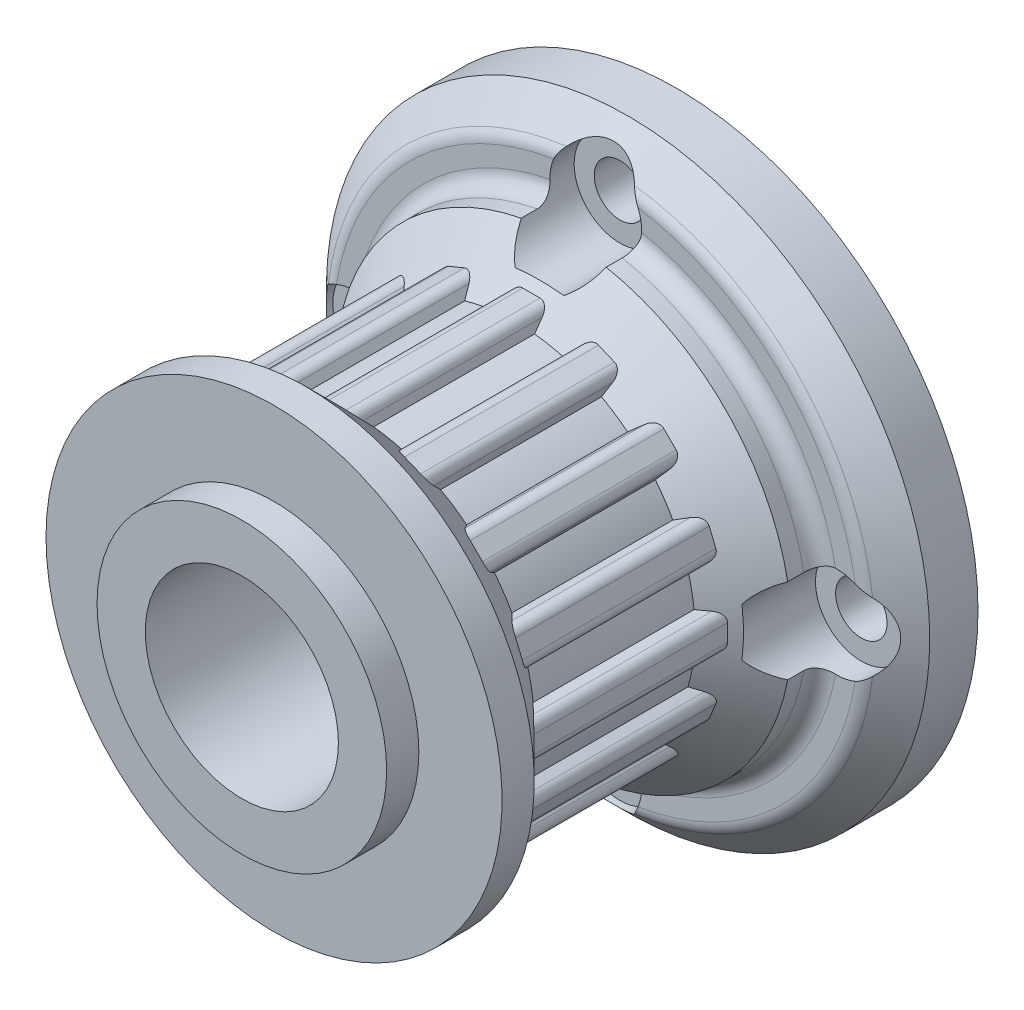
from build123d import *
from build123d.topology import SkipClean

# Parameters (mm, degrees)
ESQUISSE11_R                 = 18.75
ESQUISSE11_R_2               = 1.6
BOSS_EXTRU_4_DEPTH           = 5
ESQUISSE5_R                  = 6
BOSS_EXTRU_5_DEPTH           = 24
ESQUISSE12_R                 = 1.6
ENL_V_MAT_EXTRU_7_DEPTH      = 32
ENL_V_MAT_EXTRU_9_DEPTH      = 3.5
ENL_V_MAT_EXTRU_9_DEPTH_BACK = 1.5
ESQUISSE15_R                 = 2.85
CHANFREIN1_SIZE              = 2
CONG_1_R                     = 1
ESQUISSE16_R                 = 9
ESQUISSE16_R_2               = 6
BOSS_EXTRU_6_DEPTH           = 2


with BuildPart() as part:
    # Esquisse11 → Boss.-Extru.4 (new body)
    with BuildSketch(Plane.XY):
        Circle(ESQUISSE11_R)
        with Locations((-15, 0)):
            Circle(ESQUISSE11_R_2, mode=Mode.SUBTRACT)
        with Locations((0, 15)):
            Circle(ESQUISSE11_R_2, mode=Mode.SUBTRACT)
        with Locations((15, 0)):
            Circle(ESQUISSE11_R_2, mode=Mode.SUBTRACT)
        with Locations((0, -15)):
            Circle(ESQUISSE11_R_2, mode=Mode.SUBTRACT)
    extrude(amount=BOSS_EXTRU_4_DEPTH)

    # Esquisse5 → Boss.-Extru.5 (add)
    with BuildSketch(Plane.XY):
        with BuildLine():
            Line((0, 12.187189413), (0.508919212, 12.187189413))
            ThreePointArc((0.508919212, 12.187189413), (0.899044051, 12.043043128), (1.101718736, 11.679864778))
            Line((1.101718736, 11.679864778), (1.223875428, 10.898487461))
            Line((1.223875428, 10.898487461), (2.990113971, 10.551498398))
            Line((2.990113971, 10.551498398), (3.397524082, 11.2264814))
            ThreePointArc((3.397524082, 11.2264814), (3.723877023, 11.486437733), (4.140815501, 11.470758379))
            Line((4.140815501, 11.470758379), (4.661933908, 11.254904067))
            Line((4.661933908, 11.254904067), (5.132113951, 11.060149116))
            ThreePointArc((5.132113951, 11.060149116), (5.43737991, 10.777681002), (5.485644567, 10.364587714))
            Line((5.485644567, 10.364587714), (5.29948248, 9.595941861))
            Line((5.29948248, 9.595941861), (6.798487154, 8.59945554))
            Line((6.798487154, 8.59945554), (7.433189829, 9.06714942))
            ThreePointArc((7.433189829, 9.06714942), (7.834181612, 9.182427892), (8.21338231, 9.00838661))
            Line((8.21338231, 9.00838661), (8.612229071, 8.609539849))
            Line((8.612229071, 8.609539849), (8.972089297, 8.249679623))
            ThreePointArc((8.972089297, 8.249679623), (9.146022401, 7.871892888), (9.032529172, 7.47177437))
            Line((9.032529172, 7.47177437), (8.566389797, 6.832879345))
            Line((8.566389797, 6.832879345), (9.569950728, 5.338601775))
            Line((9.569950728, 5.338601775), (10.335318239, 5.52780438))
            ThreePointArc((10.335318239, 5.52780438), (10.749901501, 5.480854889), (11.033634549, 5.174947886))
            Line((11.033634549, 5.174947886), (11.249488861, 4.653829479))
            Line((11.249488861, 4.653829479), (11.444243812, 4.183649436))
            ThreePointArc((11.444243812, 4.183649436), (11.460364322, 3.768058687), (11.202391523, 3.441829356))
            Line((11.202391523, 3.441829356), (10.527240354, 3.029951135))
            Line((10.527240354, 3.029951135), (10.882574489, 1.26537253))
            Line((10.882574489, 1.26537253), (11.662086569, 1.147279478))
            ThreePointArc((11.662086569, 1.147279478), (12.027144767, 0.945249658), (12.172214381, 0.554048503))
            Line((12.172214381, 0.554048503), (12.172214381, -0.010005996))
            Line((12.172214381, -0.010005996), (12.172214381, -0.518925208))
            ThreePointArc((12.172214381, -0.518925208), (12.028068096, -0.909050047), (11.664889747, -1.111724733))
            Line((11.664889747, -1.111724733), (10.88351243, -1.233881424))
            Line((10.88351243, -1.233881424), (10.536523367, -3.000119967))
            Line((10.536523367, -3.000119967), (11.211506369, -3.407530078))
            ThreePointArc((11.211506369, -3.407530078), (11.471462701, -3.733883019), (11.455783348, -4.150821497))
            Line((11.455783348, -4.150821497), (11.239929036, -4.671939904))
            Line((11.239929036, -4.671939904), (11.045174085, -5.142119947))
            ThreePointArc((11.045174085, -5.142119947), (10.76270597, -5.447385906), (10.349612682, -5.495650563))
            Line((10.349612682, -5.495650563), (9.580966829, -5.309488476))
            Line((9.580966829, -5.309488476), (8.584480508, -6.80849315))
            Line((8.584480508, -6.80849315), (9.052174389, -7.443195825))
            ThreePointArc((9.052174389, -7.443195825), (9.167452861, -7.844187609), (8.993411579, -8.223388306))
            Line((8.993411579, -8.223388306), (8.594564817, -8.622235067))
            Line((8.594564817, -8.622235067), (8.234704592, -8.982095293))
            ThreePointArc((8.234704592, -8.982095293), (7.856917857, -9.156028397), (7.456799339, -9.042535168))
            Line((7.456799339, -9.042535168), (6.817904314, -8.576395793))
            Line((6.817904314, -8.576395793), (5.323626744, -9.579956724))
            Line((5.323626744, -9.579956724), (5.512829349, -10.345324235))
            ThreePointArc((5.512829349, -10.345324235), (5.465879858, -10.759907497), (5.159972855, -11.043640545))
            Line((5.159972855, -11.043640545), (4.638854448, -11.259494857))
            Line((4.638854448, -11.259494857), (4.168674404, -11.454249808))
            ThreePointArc((4.168674404, -11.454249808), (3.753083655, -11.470370318), (3.426854324, -11.212397519))
            Line((3.426854324, -11.212397519), (3.014976103, -10.53724635))
            Line((3.014976103, -10.53724635), (1.250397498, -10.892580485))
            Line((1.250397498, -10.892580485), (1.132304447, -11.672092565))
            ThreePointArc((1.132304447, -11.672092565), (0.930274627, -12.037150763), (0.539073472, -12.182220377))
            Line((0.539073472, -12.182220377), (-0.024981027, -12.182220377))
            Line((-0.024981027, -12.182220377), (-0.533900239, -12.182220377))
            ThreePointArc((-0.533900239, -12.182220377), (-0.924025078, -12.038074093), (-1.126699764, -11.674895743))
            Line((-1.126699764, -11.674895743), (-1.248856456, -10.893518426))
            Line((-1.248856456, -10.893518426), (-3.015094998, -10.546529363))
            Line((-3.015094998, -10.546529363), (-3.42250511, -11.221512365))
            ThreePointArc((-3.42250511, -11.221512365), (-3.74885805, -11.481468697), (-4.165796528, -11.465789344))
            Line((-4.165796528, -11.465789344), (-4.686914935, -11.249935032))
            Line((-4.686914935, -11.249935032), (-5.157094979, -11.055180081))
            ThreePointArc((-5.157094979, -11.055180081), (-5.462360938, -10.772711966), (-5.510625594, -10.359618678))
            Line((-5.510625594, -10.359618678), (-5.324463507, -9.590972826))
            Line((-5.324463507, -9.590972826), (-6.823468181, -8.594486504))
            Line((-6.823468181, -8.594486504), (-7.458170856, -9.062180385))
            ThreePointArc((-7.458170856, -9.062180385), (-7.85916264, -9.177458857), (-8.238363337, -9.003417575))
            Line((-8.238363337, -9.003417575), (-8.637210099, -8.604570813))
            Line((-8.637210099, -8.604570813), (-8.997070324, -8.244710588))
            ThreePointArc((-8.997070324, -8.244710588), (-9.171003428, -7.866923853), (-9.057510199, -7.466805335))
            Line((-9.057510199, -7.466805335), (-8.591370824, -6.82791031))
            Line((-8.591370824, -6.82791031), (-9.594931756, -5.33363274))
            Line((-9.594931756, -5.33363274), (-10.360299266, -5.522835345))
            ThreePointArc((-10.360299266, -5.522835345), (-10.774882529, -5.475885854), (-11.058615577, -5.169978851))
            Line((-11.058615577, -5.169978851), (-11.274469888, -4.648860444))
            Line((-11.274469888, -4.648860444), (-11.469224839, -4.178680401))
            ThreePointArc((-11.469224839, -4.178680401), (-11.48534535, -3.763089651), (-11.22737255, -3.43686032))
            Line((-11.22737255, -3.43686032), (-10.552221381, -3.024982099))
            Line((-10.552221381, -3.024982099), (-10.907555516, -1.260403495))
            Line((-10.907555516, -1.260403495), (-11.687067596, -1.142310443))
            ThreePointArc((-11.687067596, -1.142310443), (-12.052125795, -0.940280623), (-12.197195409, -0.549079468))
            Line((-12.197195409, -0.549079468), (-12.197195409, 0.014975031))
            Line((-12.197195409, 0.014975031), (-12.197195409, 0.523894243))
            ThreePointArc((-12.197195409, 0.523894243), (-12.053049124, 0.914019082), (-11.689870774, 1.116693768))
            Line((-11.689870774, 1.116693768), (-10.908493457, 1.238850459))
            Line((-10.908493457, 1.238850459), (-10.561504394, 3.005089002))
            Line((-10.561504394, 3.005089002), (-11.236487396, 3.412499114))
            ThreePointArc((-11.236487396, 3.412499114), (-11.496443729, 3.738852054), (-11.480764375, 4.155790532))
            Line((-11.480764375, 4.155790532), (-11.264910063, 4.676908939))
            Line((-11.264910063, 4.676908939), (-11.070155112, 5.147088983))
            ThreePointArc((-11.070155112, 5.147088983), (-10.787686998, 5.452354942), (-10.37459371, 5.500619598))
            Line((-10.37459371, 5.500619598), (-9.605947857, 5.314457511))
            Line((-9.605947857, 5.314457511), (-8.609461536, 6.813462185))
            Line((-8.609461536, 6.813462185), (-9.077155416, 7.44816486))
            ThreePointArc((-9.077155416, 7.44816486), (-9.192433888, 7.849156644), (-9.018392606, 8.228357341))
            Line((-9.018392606, 8.228357341), (-8.619545845, 8.627204103))
            Line((-8.619545845, 8.627204103), (-8.259685619, 8.987064328))
            ThreePointArc((-8.259685619, 8.987064328), (-7.881898884, 9.160997432), (-7.481780366, 9.047504203))
            Line((-7.481780366, 9.047504203), (-6.842885341, 8.581364828))
            Line((-6.842885341, 8.581364828), (-5.348607771, 9.58492576))
            Line((-5.348607771, 9.58492576), (-5.537810376, 10.35029327))
            ThreePointArc((-5.537810376, 10.35029327), (-5.490860885, 10.764876533), (-5.184953883, 11.04860958))
            Line((-5.184953883, 11.04860958), (-4.663835475, 11.264463892))
            Line((-4.663835475, 11.264463892), (-4.193655432, 11.459218843))
            ThreePointArc((-4.193655432, 11.459218843), (-3.778064683, 11.475339354), (-3.451835352, 11.217366554))
            Line((-3.451835352, 11.217366554), (-3.039957131, 10.542215385))
            Line((-3.039957131, 10.542215385), (-1.275378526, 10.89754952))
            Line((-1.275378526, 10.89754952), (-1.157285475, 11.6770616))
            ThreePointArc((-1.157285475, 11.6770616), (-0.955255654, 12.042119799), (-0.564054499, 12.187189413))
            Line((-0.564054499, 12.187189413), (0, 12.187189413))
        make_face()
        Circle(ESQUISSE5_R, mode=Mode.SUBTRACT)
    extrude(amount=BOSS_EXTRU_5_DEPTH)

    # Esquisse12 → Enlèv. mat.-Extru.7 (cut)
    with BuildSketch(Plane.XY.offset(5)):
        Circle(ESQUISSE12_R)
    extrude(amount=-ENL_V_MAT_EXTRU_7_DEPTH, mode=Mode.SUBTRACT)

    # Esquisse13 → Révolution1 (revolve)
    with BuildSketch(Plane(origin=(0, 0, 0), x_dir=(1, 0, 0), z_dir=(0, 1, 0)), mode=Mode.PRIVATE) as r_volution1_sk:
        Polygon((6, -5), (6, -25), (14.172214381, -25), (14.172214381, -23), (11.172214381, -20), (11.172214381, -10), (14.172214381, -7), (14.172214381, -5), align=None)
    revolve(r_volution1_sk.sketch.rotate(Axis((0, 0, 0), (0, 0, 1)), 180), axis=Axis((0, 0, 0), (0, 0, 1)))

    # Esquisse15 → Enlèv. mat.-Extru.9 (cut, two sides: drawn at the far end of the back side and taken through both)
    with BuildSketch(Plane.XY.offset(5).offset(-ENL_V_MAT_EXTRU_9_DEPTH_BACK)):
        with Locations(Location((15, 0, 0), (0, 0, 211.962839165))):
            Circle(ESQUISSE15_R)
        with Locations(Location((0, 15, 0), (0, 0, 202.174997284))):
            Circle(ESQUISSE15_R)
        with Locations(Location((0, -15, 0), (0, 0, 157.825002716))):
            Circle(ESQUISSE15_R)
        with Locations(Location((-15, 0, 0), (0, 0, 292.174997284))):
            Circle(ESQUISSE15_R)
    extrude(amount=ENL_V_MAT_EXTRU_9_DEPTH + ENL_V_MAT_EXTRU_9_DEPTH_BACK, mode=Mode.SUBTRACT)

    # Chanfrein1
    # the kernel refuses this chamfer: 2 mm, written as the material it takes off along each edge
    with BuildSketch(Plane(origin=(0, 0, 5), x_dir=(1, 0, 0), z_dir=(0, -1, 0))) as chanfrein1_piece_1:
        Polygon((18.75, -CHANFREIN1_SIZE), (18.75 - CHANFREIN1_SIZE, 0), (18.75, 0), align=None)
    revolve(axis=Axis((0, 0, 5), (0, 0, 1)), mode=Mode.SUBTRACT)

    # Congé1
    # the kernel refuses this fillet: 1 mm, written as the material it adds along each edge
    with BuildSketch(Plane(origin=(0, 0, 5), x_dir=(0.9999408731145155, 0.010874294229071135, 0), z_dir=(0.010874294229071135, -0.9999408731145155, 0))) as cong_1_piece_1_section:
        with BuildLine():
            CenterArc((14.172214381 + CONG_1_R, CONG_1_R), CONG_1_R, 180, 90)
            Line((14.172214381 + CONG_1_R, 0), (14.172214381, 0))
            Line((14.172214381, 0), (14.172214381, CONG_1_R))
        make_face()
    cong_1_piece_1 = revolve(axis=Axis((0, 0, 5), (0, 0, 1)), revolution_arc=88.753873111, mode=Mode.PRIVATE)
    cong_1_piece_1 = cong_1_piece_1 - Plane(origin=(15, 0, 5.281325989), x_dir=(-0.848391612230621, -0.5293691266939616, 0), z_dir=(0, 0, 1)) * Cylinder(2.85, 61, mode=Mode.PRIVATE)
    cong_1_piece_1 = cong_1_piece_1 - Plane(origin=(0, 15, 5.281325989), x_dir=(-0.9260353787045638, -0.37743671971271575, 0), z_dir=(0, 0, 1)) * Cylinder(2.85, 61, mode=Mode.PRIVATE)
    add(cong_1_piece_1)
    with BuildSketch(Plane(origin=(0, 0, 5), x_dir=(-0.010874294228895224, 0.9999408731145174, 0), z_dir=(0.9999408731145174, 0.010874294228895224, 0))) as cong_1_piece_2_section:
        with BuildLine():
            CenterArc((14.172214381 + CONG_1_R, CONG_1_R), CONG_1_R, 180, 90)
            Line((14.172214381 + CONG_1_R, 0), (14.172214381, 0))
            Line((14.172214381, 0), (14.172214381, CONG_1_R))
        make_face()
    cong_1_piece_2 = revolve(axis=Axis((0, 0, 5), (0, 0, 1)), revolution_arc=88.753873111, mode=Mode.PRIVATE)
    cong_1_piece_2 = cong_1_piece_2 - Plane(origin=(0, 15, 5.281325989), x_dir=(-0.9260353787045638, -0.37743671971271575, 0), z_dir=(0, 0, 1)) * Cylinder(2.85, 61, mode=Mode.PRIVATE)
    cong_1_piece_2 = cong_1_piece_2 - Plane(origin=(-15, 0, 5.281325989), x_dir=(0.3774367197127166, -0.9260353787045635, 0), z_dir=(0, 0, 1)) * Cylinder(2.85, 61, mode=Mode.PRIVATE)
    add(cong_1_piece_2)
    with BuildSketch(Plane(origin=(0, 0, 5), x_dir=(-0.9999408731145171, -0.010874294228923716, 0), z_dir=(-0.010874294228923716, 0.9999408731145171, 0))) as cong_1_piece_3_section:
        with BuildLine():
            CenterArc((14.172214381 + CONG_1_R, CONG_1_R), CONG_1_R, 180, 90)
            Line((14.172214381 + CONG_1_R, 0), (14.172214381, 0))
            Line((14.172214381, 0), (14.172214381, CONG_1_R))
        make_face()
    cong_1_piece_3 = revolve(axis=Axis((0, 0, 5), (0, 0, 1)), revolution_arc=88.753873111, mode=Mode.PRIVATE)
    cong_1_piece_3 = cong_1_piece_3 - Plane(origin=(-15, 0, 5.281325989), x_dir=(0.3774367197127166, -0.9260353787045635, 0), z_dir=(0, 0, 1)) * Cylinder(2.85, 61, mode=Mode.PRIVATE)
    cong_1_piece_3 = cong_1_piece_3 - Plane(origin=(0, -15, 5.281325989), x_dir=(-0.9260353787045638, 0.37743671971271603, 0), z_dir=(0, 0, 1)) * Cylinder(2.85, 61, mode=Mode.PRIVATE)
    add(cong_1_piece_3)
    with BuildSketch(Plane(origin=(0, 0, 5), x_dir=(0.010874294229040776, -0.9999408731145158, 0), z_dir=(-0.9999408731145158, -0.010874294229040776, 0))) as cong_1_piece_4_section:
        with BuildLine():
            CenterArc((14.172214381 + CONG_1_R, CONG_1_R), CONG_1_R, 180, 90)
            Line((14.172214381, CONG_1_R), (14.172214381, 0))
            Line((14.172214381, 0), (14.172214381 + CONG_1_R, 0))
        make_face()
    cong_1_piece_4 = revolve(axis=Axis((0, 0, 5), (0, 0, 1)), revolution_arc=88.753873111, mode=Mode.PRIVATE)
    cong_1_piece_4 = cong_1_piece_4 - Plane(origin=(0, -15, 5.281325989), x_dir=(-0.9260353787045638, 0.37743671971271603, 0), z_dir=(0, 0, 1)) * Cylinder(2.85, 61, mode=Mode.PRIVATE)
    cong_1_piece_4 = cong_1_piece_4 - Plane(origin=(15, 0, 5.281325989), x_dir=(-0.848391612230621, -0.5293691266939616, 0), z_dir=(0, 0, 1)) * Cylinder(2.85, 61, mode=Mode.PRIVATE)
    add(cong_1_piece_4)
    # the kernel refuses this fillet: 1 mm, written as the material it takes off along each edge
    with BuildSketch(Plane(origin=(0, 0, 5), x_dir=(0.9967862813377023, 0.08010686198419449, 0), z_dir=(0.08010686198419449, -0.9967862813377023, 0))) as cong_1_2_piece_1:
        with BuildLine():
            CenterArc((16.75 - CONG_1_R * 0.414213562373, -CONG_1_R), CONG_1_R, 45, 45)
            Line((16.75 - CONG_1_R * 0.414213562373, 0), (16.75, 0))
            Line((16.75, 0), (16.75 + CONG_1_R * 0.292893218813, -CONG_1_R * 0.292893218813))
        make_face()
    revolve(axis=Axis((0, 0, 5), (0, 0, 1)), revolution_arc=80.81058362, mode=Mode.SUBTRACT)
    with BuildSketch(Plane(origin=(0, 0, 5), x_dir=(0.08010686198416156, -0.9967862813377051, 0), z_dir=(-0.9967862813377051, -0.08010686198416156, 0))) as cong_1_2_piece_2:
        with BuildLine():
            CenterArc((16.75 - CONG_1_R * 0.414213562373, -CONG_1_R), CONG_1_R, 45, 45)
            Line((16.75 - CONG_1_R * 0.414213562373, 0), (16.75, 0))
            Line((16.75, 0), (16.75 + CONG_1_R * 0.292893218813, -CONG_1_R * 0.292893218813))
        make_face()
    revolve(axis=Axis((0, 0, 5), (0, 0, 1)), revolution_arc=80.81058362, mode=Mode.SUBTRACT)
    with BuildSketch(Plane(origin=(0, 0, 5), x_dir=(-0.9967862813377025, -0.08010686198419305, 0), z_dir=(-0.08010686198419305, 0.9967862813377025, 0))) as cong_1_2_piece_3:
        with BuildLine():
            CenterArc((16.75 - CONG_1_R * 0.414213562373, -CONG_1_R), CONG_1_R, 45, 45)
            Line((16.75 - CONG_1_R * 0.414213562373, 0), (16.75, 0))
            Line((16.75, 0), (16.75 + CONG_1_R * 0.292893218813, -CONG_1_R * 0.292893218813))
        make_face()
    revolve(axis=Axis((0, 0, 5), (0, 0, 1)), revolution_arc=80.81058362, mode=Mode.SUBTRACT)
    with BuildSketch(Plane(origin=(0, 0, 5), x_dir=(-0.0801068619841608, 0.9967862813377051, 0), z_dir=(0.9967862813377051, 0.0801068619841608, 0))) as cong_1_2_piece_4:
        with BuildLine():
            CenterArc((16.75 - CONG_1_R * 0.414213562373, -CONG_1_R), CONG_1_R, 45, 45)
            Line((16.75 - CONG_1_R * 0.414213562373, 0), (16.75, 0))
            Line((16.75, 0), (16.75 + CONG_1_R * 0.292893218813, -CONG_1_R * 0.292893218813))
        make_face()
    revolve(axis=Axis((0, 0, 5), (0, 0, 1)), revolution_arc=80.81058362, mode=Mode.SUBTRACT)

    # Esquisse16 → Boss.-Extru.6 (add)
    with SkipClean():  # the faces are left unmerged after this step: merging them gives an invalid solid
        with BuildSketch(Plane.XY.offset(25)):
            with Locations(Location((0, 0, 0), (0, 0, 180))):
                Circle(ESQUISSE16_R)
            Circle(ESQUISSE16_R_2, mode=Mode.SUBTRACT)
        extrude(amount=BOSS_EXTRU_6_DEPTH)
    add(part.part.scale(1), mode=Mode.REPLACE)  # the faces are merged on a copy


solid = part.part
